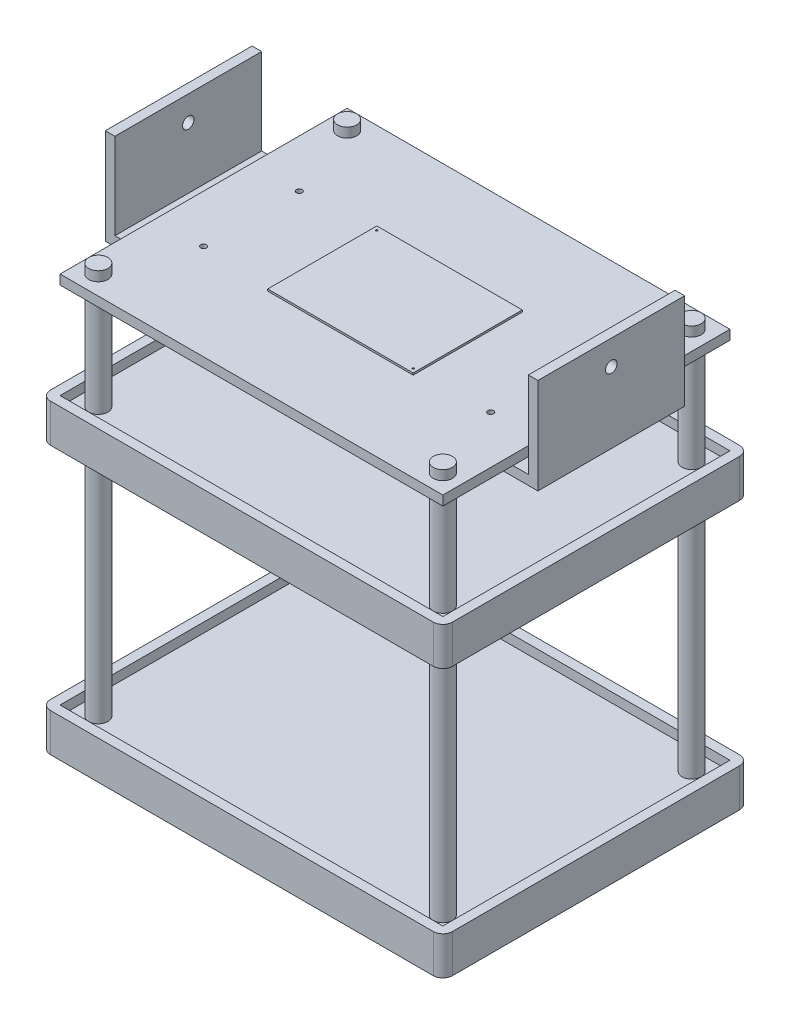
from build123d import *

# Parameters (mm, degrees)
SKETCH1_W            = 200
SKETCH1_H            = 150
BOSS_EXTRUDE1_DEPTH  = 5
SKETCH2_R            = 5
CUT_EXTRUDE1_DEPTH   = 10
SKETCH3_W            = 200
SKETCH3_H            = 150
SKETCH3_R            = 5
BOSS_EXTRUDE2_DEPTH  = 5
SKETCH4_W            = 200
SKETCH4_H            = 150
SKETCH4_R            = 5
BOSS_EXTRUDE3_DEPTH  = 5
BOSS_EXTRUDE13_START = 205
SKETCH21_R           = 5
BOSS_EXTRUDE13_DEPTH = 205
SKETCH22_R           = 5
BOSS_EXTRUDE14_DEPTH = 15
SKETCH23_R           = 1.5
CUT_EXTRUDE2_DEPTH   = 10
SKETCH27_W           = 76
SKETCH27_H           = 57
BOSS_EXTRUDE16_DEPTH = 1
SKETCH30_R           = 0.5
CUT_EXTRUDE3_DEPTH   = 30
SKETCH35_W           = 210
SKETCH35_H           = 160
SKETCH35_W_2         = 200
SKETCH35_H_2         = 150
BOSS_EXTRUDE19_DEPTH = 10
FILLET4_R            = 5
SKETCH39_W           = 210
SKETCH39_H           = 160
SKETCH39_W_2         = 200
SKETCH39_H_2         = 150
BOSS_EXTRUDE20_DEPTH = 10
FILLET5_R            = 5
SKETCH42_W           = 15
SKETCH42_H           = 20
SKETCH42_W_2         = 25
SKETCH42_H_2         = 50
SKETCH42_W_3         = 43.3
SKETCH42_H_3         = 43.3
BOSS_EXTRUDE23_DEPTH = 1
SKETCH46_W           = 30
SKETCH46_H           = 76.670556204
BOSS_EXTRUDE24_DEPTH = 5
SKETCH48_W           = 76.670556204
SKETCH48_H           = 50
BOSS_EXTRUDE25_DEPTH = 5
SKETCH49_R           = 3
CUT_EXTRUDE4_DEPTH   = 5
SKETCH54_W           = 76.670556204
SKETCH54_H           = 50
BOSS_EXTRUDE26_DEPTH = 5
CUT_EXTRUDE5_START   = -5
SKETCH55_R           = 3
CUT_EXTRUDE5_DEPTH   = 5


with BuildPart() as part:
    # Sketch1 → Boss-Extrude1 (new body)
    with BuildSketch(Plane(origin=(0, 0, 0), x_dir=(1, 0, 0), z_dir=(0, 1, 0))):
        Rectangle(SKETCH1_W, SKETCH1_H)
    extrude(amount=BOSS_EXTRUDE1_DEPTH)

    # Sketch2 → Cut-Extrude1 (cut)
    with BuildSketch(Plane(origin=(0, 5, 0), x_dir=(1, 0, 0), z_dir=(0, 1, 0))):
        with Locations((-90, 65)):
            Circle(SKETCH2_R)
        with Locations((90, 65)):
            Circle(SKETCH2_R)
        with Locations((90, -65)):
            Circle(SKETCH2_R)
        with Locations((-90, -65)):
            Circle(SKETCH2_R)
    extrude(amount=-CUT_EXTRUDE1_DEPTH, mode=Mode.SUBTRACT)



with BuildPart() as body_2:
    # Sketch3 → Boss-Extrude2 (new body)
    with BuildSketch(Plane(origin=(0, 140, 0), x_dir=(1, 0, 0), z_dir=(0, 1, 0))):
        Rectangle(SKETCH3_W, SKETCH3_H)
        with Locations((-90, 65)):
            Circle(SKETCH3_R, mode=Mode.SUBTRACT)
        with Locations((90, 65)):
            Circle(SKETCH3_R, mode=Mode.SUBTRACT)
        with Locations((-90, -65)):
            Circle(SKETCH3_R, mode=Mode.SUBTRACT)
        with Locations((90, -65)):
            Circle(SKETCH3_R, mode=Mode.SUBTRACT)
    extrude(amount=BOSS_EXTRUDE2_DEPTH)



with BuildPart() as body_3:
    # Sketch4 → Boss-Extrude3 (new body)
    with BuildSketch(Plane(origin=(0, 200, 0), x_dir=(1, 0, 0), z_dir=(0, 1, 0))):
        Rectangle(SKETCH4_W, SKETCH4_H)
        with Locations((-90, 65)):
            Circle(SKETCH4_R, mode=Mode.SUBTRACT)
        with Locations((90, 65)):
            Circle(SKETCH4_R, mode=Mode.SUBTRACT)
        with Locations((90, -65)):
            Circle(SKETCH4_R, mode=Mode.SUBTRACT)
        with Locations((-90, -65)):
            Circle(SKETCH4_R, mode=Mode.SUBTRACT)
    extrude(amount=BOSS_EXTRUDE3_DEPTH)


with BuildPart() as body_2_1:
    add(body_2.part)

    add(body_3.part)  # Boss-Extrude13 merges body 3
    # Sketch21 → Boss-Extrude13 (add)
    with BuildSketch(Plane(origin=(0, 5, 0), x_dir=(1, 0, 0), z_dir=(0, 1, 0)).offset(BOSS_EXTRUDE13_START)):
        with Locations((-90, -65)):
            Circle(SKETCH21_R)
        with Locations((-90, 65)):
            Circle(SKETCH21_R)
        with Locations((90, 65)):
            Circle(SKETCH21_R)
        with Locations((90, -65)):
            Circle(SKETCH21_R)
    extrude(amount=-BOSS_EXTRUDE13_DEPTH)


with BuildPart() as part_1:
    add(part.part)

    add(body_2_1.part)  # Boss-Extrude14 merges body 2
    # Sketch22 → Boss-Extrude14 (add)
    with BuildSketch(Plane(origin=(0, 5, 0), x_dir=(1, 0, 0), z_dir=(0, 1, 0))):
        with Locations((-90, 65)):
            Circle(SKETCH22_R)
        with Locations((-90, -65)):
            Circle(SKETCH22_R)
        with Locations((90, -65)):
            Circle(SKETCH22_R)
        with Locations((90, 65)):
            Circle(SKETCH22_R)
    extrude(amount=-BOSS_EXTRUDE14_DEPTH)

    # Sketch23 → Cut-Extrude2 (cut)
    with BuildSketch(Plane(origin=(0, 205, 0), x_dir=(1, 0, 0), z_dir=(0, 1, 0))):
        with Locations((-75, 25)):
            Circle(SKETCH23_R)
        with Locations((-75, -25)):
            Circle(SKETCH23_R)
        with Locations((75, -25)):
            Circle(SKETCH23_R)
        with Locations((75, 25)):
            Circle(SKETCH23_R)
    extrude(amount=-CUT_EXTRUDE2_DEPTH, mode=Mode.SUBTRACT)

    # Sketch27 → Boss-Extrude16 (add)
    with BuildSketch(Plane(origin=(0, 205, 0), x_dir=(1, 0, 0), z_dir=(0, 1, 0))):
        Rectangle(SKETCH27_W, SKETCH27_H)
    extrude(amount=BOSS_EXTRUDE16_DEPTH)

    # Sketch30 → Cut-Extrude3 (cut)
    with BuildSketch(Plane(origin=(0, 206, 0), x_dir=(1, 0, 0), z_dir=(0, 1, 0))):
        with Locations((-36, 26.5)):
            Circle(SKETCH30_R)
        with Locations((36, -26.5)):
            Circle(SKETCH30_R)
    extrude(amount=-CUT_EXTRUDE3_DEPTH, mode=Mode.SUBTRACT)

    # Sketch42 → Boss-Extrude23 (add)
    with BuildSketch(Plane.XZ.offset(-200)):
        Rectangle(SKETCH42_W, SKETCH42_H)
        with Locations((-58.240305189, 7.803312526)):
            Rectangle(SKETCH42_W_2, SKETCH42_H_2)
        with Locations((37.35, 2.211754737)):
            Rectangle(SKETCH42_W_3, SKETCH42_H_3)
    extrude(amount=BOSS_EXTRUDE23_DEPTH)

    # Sketch46 → Boss-Extrude24 (add)
    with BuildSketch(Plane(origin=(0, 200, 0), x_dir=(-1, 0, 0), z_dir=(0, -1, 0))):
        with Locations((-93, 0)):
            Rectangle(SKETCH46_W, SKETCH46_H)
        with Locations((93, 0)):
            Rectangle(SKETCH46_W, SKETCH46_H)
    extrude(amount=BOSS_EXTRUDE24_DEPTH)

    # Sketch48 → Boss-Extrude25 (add)
    with BuildSketch(Plane.ZY.offset(108)):
        with Locations((0, 220)):
            Rectangle(SKETCH48_W, SKETCH48_H)
    extrude(amount=BOSS_EXTRUDE25_DEPTH)

    # Sketch49 → Cut-Extrude4 (cut)
    with BuildSketch(Plane.ZY.offset(113)):
        with Locations((0, 232)):
            Circle(SKETCH49_R)
    extrude(amount=-CUT_EXTRUDE4_DEPTH, mode=Mode.SUBTRACT)

    # Sketch54 → Boss-Extrude26 (add)
    with BuildSketch(Plane(origin=(108, 0, 0), x_dir=(0, 0, -1), z_dir=(1, 0, 0))):
        with Locations((0, 220)):
            Rectangle(SKETCH54_W, SKETCH54_H)
    extrude(amount=BOSS_EXTRUDE26_DEPTH)

    # Sketch55 → Cut-Extrude5 (cut)
    with BuildSketch(Plane(origin=(113, 0, 0), x_dir=(0, 0, -1), z_dir=(1, 0, 0)).offset(CUT_EXTRUDE5_START)):
        with Locations((0, 232)):
            Circle(SKETCH55_R)
    extrude(amount=CUT_EXTRUDE5_DEPTH, mode=Mode.SUBTRACT)


with BuildPart() as body_2_2:
    # Sketch35 → Boss-Extrude19 (new, symmetric)
    with BuildSketch(Plane(origin=(0, 0, 0), x_dir=(-1, 0, 0), z_dir=(0, -1, 0))):
        Rectangle(SKETCH35_W, SKETCH35_H)
        Rectangle(SKETCH35_W_2, SKETCH35_H_2, mode=Mode.SUBTRACT)
    extrude(amount=BOSS_EXTRUDE19_DEPTH, both=True)

    # Fillet4
    fillet4_edges = [body_2_2.edges().sort_by_distance(p)[0] for p in [
        (105, 0, 80),
        (105, 0, -80),
        (-105, 0, 80),
        (-105, 0, -80),
    ]]
    fillet(fillet4_edges, radius=FILLET4_R)


with BuildPart() as body_3_2:
    # Sketch39 → Boss-Extrude20 (new, symmetric)
    with BuildSketch(Plane.XZ.offset(-140)):
        Rectangle(SKETCH39_W, SKETCH39_H)
        Rectangle(SKETCH39_W_2, SKETCH39_H_2, mode=Mode.SUBTRACT)
    extrude(amount=BOSS_EXTRUDE20_DEPTH, both=True)

    # Fillet5
    fillet5_edges = [body_3_2.edges().sort_by_distance(p)[0] for p in [
        (105, 140, 80),
        (105, 140, -80),
        (-105, 140, -80),
        (-105, 140, 80),
    ]]
    fillet(fillet5_edges, radius=FILLET5_R)


solid = Compound([part_1.part, body_2_2.part, body_3_2.part])
